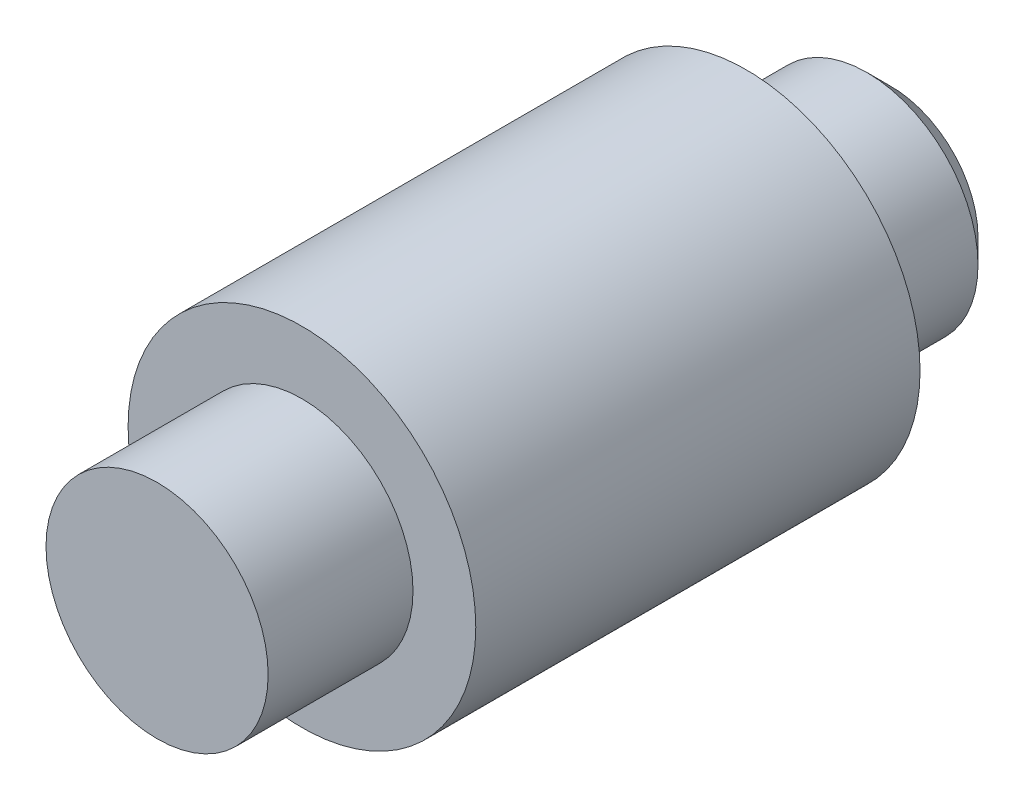
from build123d import *

# Parameters (mm, degrees)
SKETCH3_R           = 3.6
BOSS_EXTRUDE1_DEPTH = 9.2
SKETCH4_R           = 2.3
BOSS_EXTRUDE2_DEPTH = 3
BOSS_EXTRUDE3_START = 3
SKETCH5_R           = 2.3
BOSS_EXTRUDE3_DEPTH = 3
CHAMFER1_SIZE       = 0.5


with BuildPart() as part:
    # Sketch3 → Boss-Extrude1 (new body)
    with BuildSketch(Plane.XY):
        Circle(SKETCH3_R)
    extrude(amount=BOSS_EXTRUDE1_DEPTH)

    # Sketch4 → Boss-Extrude2 (add)
    with BuildSketch(Plane.XY):
        Circle(SKETCH4_R)
    extrude(amount=-BOSS_EXTRUDE2_DEPTH)

    # Sketch5 → Boss-Extrude3 (add)
    with BuildSketch(Plane.XY.offset(9.2).offset(BOSS_EXTRUDE3_START)):
        Circle(SKETCH5_R)
    extrude(amount=-BOSS_EXTRUDE3_DEPTH)

    # Chamfer1
    chamfer1_edges = [part.edges().sort_by_distance(p)[0] for p in [
        (-2.3, 0, -3),
    ]]
    chamfer(chamfer1_edges, length=CHAMFER1_SIZE)


solid = part.part
